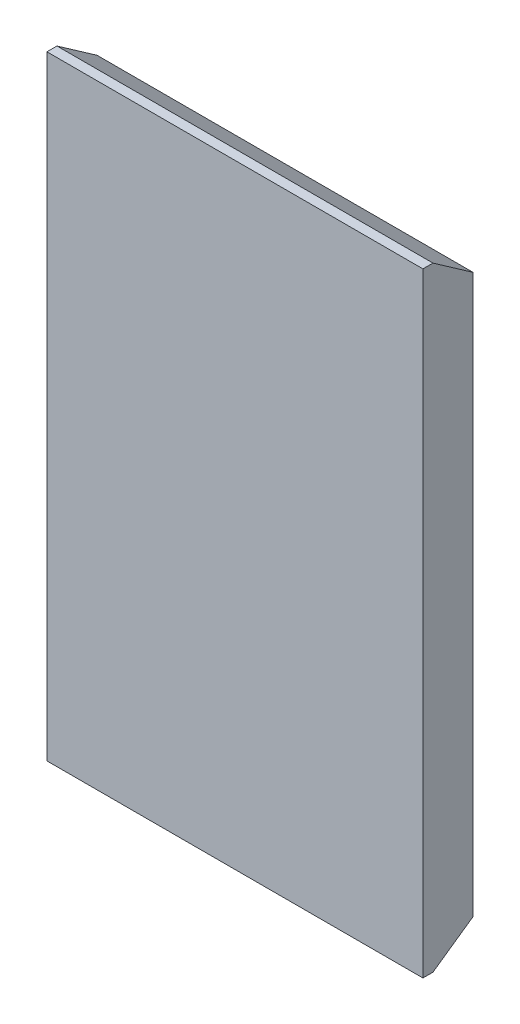
from build123d import *

# Parameters (mm, degrees)
SKETCH_1_W             = 150
SKETCH_1_H             = 245
SM_BASE_FLANGE_1_DEPTH = 20
CHAMFER_1_SIZE         = 16
CHAMFER_1_SIZE2        = 11.203320611
CHAMFER_2_SIZE         = 16
CHAMFER_2_SIZE2        = 11.203320611


# Sheet-metal steps are written as plain solids
with BuildPart() as part:
    # Sketch 1 → 基体-法兰1 (new body)
    with BuildSketch(Plane.XY):
        Rectangle(SKETCH_1_W, SKETCH_1_H)
    extrude(amount=-SM_BASE_FLANGE_1_DEPTH)

    # 倒角1
    chamfer_1_edges = [part.edges().sort_by_distance(p)[0] for p in [
        (0, 122.5, -20),
    ]]
    chamfer_1_side = [part.faces().sort_by_distance(p)[0] for p in [
        (0, 122.5, -10),
    ]]
    chamfer(chamfer_1_edges, length=CHAMFER_1_SIZE, length2=CHAMFER_1_SIZE2, reference=chamfer_1_side[0])

    # 倒角2
    chamfer_2_edges = [part.edges().sort_by_distance(p)[0] for p in [
        (0, -122.5, -20),
    ]]
    chamfer_2_side = [part.faces().sort_by_distance(p)[0] for p in [
        (0, -122.5, -10),
    ]]
    chamfer(chamfer_2_edges, length=CHAMFER_2_SIZE, length2=CHAMFER_2_SIZE2, reference=chamfer_2_side[0])


solid = part.part
